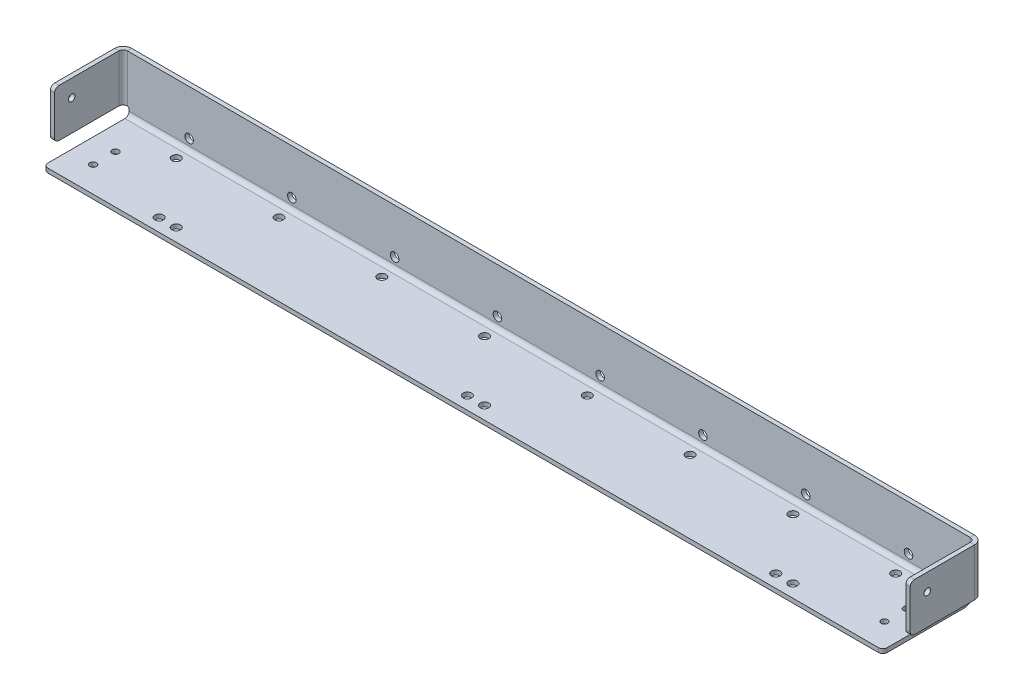
from build123d import *

# Parameters (mm, degrees)
BASE_FLANGE1_DEPTH           = 311.15
EDGE_FLANGE1_DEPTH           = 35.433
EDGE_FLANGE1_BEND_DEPTH      = 35.433
F_1_4_0_25_DIAMETER_HOLE1_D  = 6.35
F_10_0_1935_DIAMETER_HOLE1_D = 4.9149
FILLET1_R                    = 3.175
F_10_0_1935_DIAMETER_HOLE2_D = 4.9149
FILLET2_R                    = 1.524
F_1_4_0_25_DIAMETER_HOLE2_D  = 6.35
F_1_4_0_25_DIAMETER_HOLE3_D  = 6.35


# Sheet-metal steps are written as plain solids
with BuildPart() as part:
    # Sketch1 → Base-Flange1 (new, symmetric)
    with BuildSketch(Plane(origin=(0, 0, 0), x_dir=(0, 0, -1), z_dir=(1, 0, 0))):
        with BuildLine():
            Line((0, 0), (60.325, 0))
            ThreePointArc((60.325, 0), (62.57006403, 0.92993597), (63.5, 3.175))
            Line((63.5, 3.175), (63.5, 41.275))
            Line((63.5, 41.275), (66.675, 41.275))
            Line((66.675, 41.275), (66.675, 3.175))
            ThreePointArc((66.675, 3.175), (64.815128061, -1.315128061), (60.325, -3.175))
            Line((60.325, -3.175), (0, -3.175))
            Line((0, -3.175), (0, 0))
        make_face()
    extrude(amount=BASE_FLANGE1_DEPTH, both=True)

    # Edge-Flange1 section (across the edge) → Edge-Flange1 (add)
    with BuildSketch(Plane(origin=(-318.77, 41.275, -63.5), x_dir=(1, 0, 0), z_dir=(0, -1, 0))):
        with BuildLine():
            Line((0, 3.175), (0, 50.8))
            Line((0, 50.8), (3.175, 50.8))
            Line((3.175, 50.8), (3.175, 3.175))
            ThreePointArc((3.175, 3.175), (4.10493597, 0.92993597), (6.35, 0))
            Line((6.35, 0), (7.62, 0))
            Line((7.62, 0), (7.62, -3.175))
            Line((7.62, -3.175), (6.35, -3.175))
            ThreePointArc((6.35, -3.175), (1.859871939, -1.315128061), (0, 3.175))
        make_face()
    extrude(amount=EDGE_FLANGE1_DEPTH)

    # Edge-Flange1 section 2 (across the edge) → Edge-Flange1 bend (add)
    with BuildSketch(Plane(origin=(318.77, 5.842, -63.5), x_dir=(-1, 0, 0), z_dir=(0, 1, 0))):
        with BuildLine():
            Line((0, 3.175), (0, 50.8))
            Line((0, 50.8), (3.175, 50.8))
            Line((3.175, 50.8), (3.175, 3.175))
            ThreePointArc((3.175, 3.175), (4.10493597, 0.92993597), (6.35, 0))
            Line((6.35, 0), (7.62, 0))
            Line((7.62, 0), (7.62, -3.175))
            Line((7.62, -3.175), (6.35, -3.175))
            ThreePointArc((6.35, -3.175), (1.859871939, -1.315128061), (0, 3.175))
        make_face()
    extrude(amount=EDGE_FLANGE1_BEND_DEPTH)

    # 1/4 (0.25) Diameter Hole1 (through all)
    with Locations(Plane(origin=(0, 0, 0), x_dir=(1, 0, 0), z_dir=(0, 1, 0))):
        with Locations((-6.35, 9.525), (6.35, 9.525), (222.25, 9.525), (234.95, 9.525), (-222.25, 9.525), (-234.95, 9.525)):
            Hole(F_1_4_0_25_DIAMETER_HOLE1_D / 2)

    # #10 (0.1935) Diameter Hole1 (through all)
    with Locations(Plane(origin=(0, 0, 0), x_dir=(1, 0, 0), z_dir=(0, 1, 0))):
        with Locations((-293.37, 19.05), (-293.37, 35.56), (293.37, 19.05), (293.37, 35.56)):
            Hole(F_10_0_1935_DIAMETER_HOLE1_D / 2)

    # Fillet1
    fillet1_edges = [part.edges().sort_by_distance(p)[0] for p in [
        (311.15, -1.5875, 0),
        (-317.1825, 41.275, -12.7),
        (-317.1825, 5.842, -12.7),
        (317.1825, 5.842, -12.7),
        (317.1825, 41.275, -12.7),
        (-311.15, -1.5875, 0),
    ]]
    fillet(fillet1_edges, radius=FILLET1_R)

    # #10 (0.1935) Diameter Hole2 (through all)
    with Locations(Plane(origin=(318.77, 0, 0), x_dir=(0, 0, -1), z_dir=(1, 0, 0))):
        with Locations((25.4, 28.575)):
            Hole(F_10_0_1935_DIAMETER_HOLE2_D / 2)

    # Fillet2
    fillet2_edges = [part.edges().sort_by_distance(p)[0] for p in [
        (311.15, 5.842, -65.0875),
        (-311.15, 5.842, -65.0875),
    ]]
    fillet(fillet2_edges, radius=FILLET2_R)

    # 1/4 (0.25) Diameter Hole2 (through all)
    with Locations(Plane.XY.offset(-63.5)):
        with Locations((-38.1, 7.9375), (38.1, 7.9375), (114.3, 7.9375), (190.5, 7.9375), (266.7, 7.9375), (-114.3, 7.9375), (-190.5, 7.9375), (-266.7, 7.9375)):
            Hole(F_1_4_0_25_DIAMETER_HOLE2_D / 2)

    # 1/4 (0.25) Diameter Hole3 (through all)
    with Locations(Plane(origin=(0, 0, 0), x_dir=(1, 0, 0), z_dir=(0, 1, 0))):
        with Locations((-266.7, 53.975), (-190.5, 53.975), (-114.3, 53.975), (-38.1, 53.975), (38.1, 53.975), (114.3, 53.975), (190.5, 53.975), (266.7, 53.975)):
            Hole(F_1_4_0_25_DIAMETER_HOLE3_D / 2)


solid = part.part
